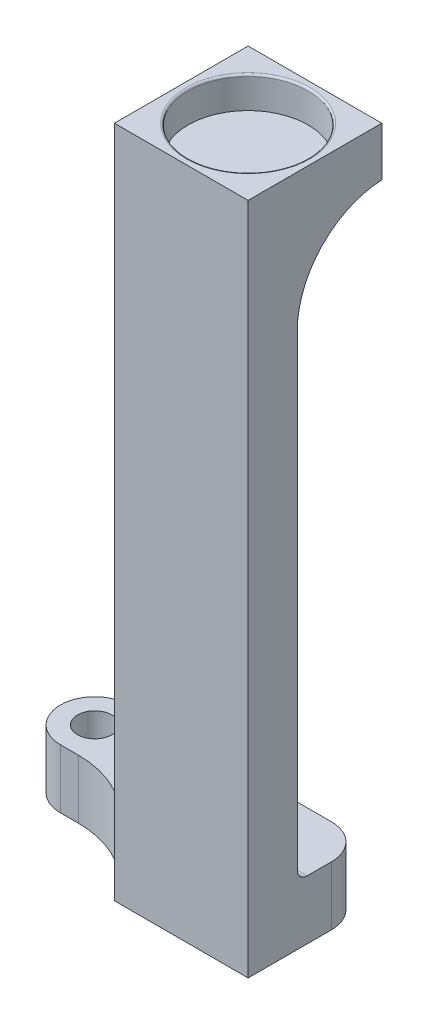
from build123d import *

# Parameters (mm, degrees)
SKETCH1_W           = 13.6
SKETCH1_H           = 13.6
BOSS_EXTRUDE1_DEPTH = 5
SKETCH2_R           = 6.1
CUT_EXTRUDE1_DEPTH  = 3.2
SKETCH3_W           = 13.6
SKETCH3_H           = 5
BOSS_EXTRUDE2_DEPTH = 63.5
FILLET1_R           = 0.2
FILLET2_R           = 9
SKETCH10_W          = 27.6
SKETCH10_H          = 6
BOSS_EXTRUDE5_DEPTH = 7
SKETCH11_R          = 1.75
CUT_EXTRUDE4_DEPTH  = 67.220314104
FILLET3_R           = 10
FILLET4_R           = 3.5
FILLET5_R           = 1


# Some blends are built 0.0001 mm under size
with BuildPart() as part:
    # Sketch1 → Boss-Extrude1 (new body)
    with BuildSketch(Plane(origin=(0, 0, 0), x_dir=(1, 0, 0), z_dir=(0, 1, 0))):
        Rectangle(SKETCH1_W, SKETCH1_H)
    extrude(amount=BOSS_EXTRUDE1_DEPTH)

    # Sketch2 → Cut-Extrude1 (cut)
    with BuildSketch(Plane(origin=(0, 5, 0), x_dir=(1, 0, 0), z_dir=(0, 1, 0))):
        with Locations(Location((0, 0, 0), (0, 0, 270))):
            Circle(SKETCH2_R)
    extrude(amount=-CUT_EXTRUDE1_DEPTH, mode=Mode.SUBTRACT)

    # Sketch3 → Boss-Extrude2 (add)
    with BuildSketch(Plane.XZ):
        with Locations((0, 4.3)):
            Rectangle(SKETCH3_W, SKETCH3_H)
    extrude(amount=BOSS_EXTRUDE2_DEPTH)

    # Fillet1
    fillet1_edges = [part.edges().sort_by_distance(p)[0] for p in [
        (0, 5, -6.1),
    ]]
    fillet(fillet1_edges, radius=FILLET1_R)

    # Fillet2
    # the kernel refuses this fillet: 9 mm, written as the material it adds along each edge
    with BuildSketch(Plane(origin=(6.8, 0, 1.8), x_dir=(0, 0, -1), z_dir=(-1, 0, 0))) as fillet2_piece_1:
        with BuildLine():
            CenterArc((9, 8.991106717), FILLET2_R, 180, 87.452681817)
            Line((0, 8.991106717), (-0.18, 8.991106717))
            Line((-0.18, 8.991106717), (-0.18, 0))
            Line((-0.18, 0), (0, -0.18))
            ThreePointArc((0, -0.18), (4.3, -0.18), (8.592, -0.179822134))
            Line((8.592, -0.179822134), (8.6, 0))
        make_face()
    extrude(amount=13.6)

    # Sketch10 → Boss-Extrude5 (add)
    with BuildSketch(Plane(origin=(0, 0, 1.8), x_dir=(-1, 0, 0), z_dir=(0, 0, -1))):
        with Locations((7, -60.5)):
            Rectangle(SKETCH10_W, SKETCH10_H)
    extrude(amount=BOSS_EXTRUDE5_DEPTH)

    # Sketch11 → Cut-Extrude4 (cut, through all)
    with BuildSketch(Plane(origin=(0, -57.5, 0), x_dir=(1, 0, 0), z_dir=(0, 1, 0))):
        with Locations(Location((-10.3, 1.7, 0), (0, 0, 270))):
            Circle(SKETCH11_R)
        with Locations(Location((-17.3, 1.7, 0), (0, 0, 270))):
            Circle(SKETCH11_R)
    extrude(amount=-CUT_EXTRUDE4_DEPTH, mode=Mode.SUBTRACT)

    # Fillet3
    # the kernel refuses this fillet: 10 mm, written as the material it adds along each edge
    with BuildSketch(Plane(origin=(-6.8, -57.5, 1.8), x_dir=(0, 0, 1), z_dir=(0, -1, 0))) as fillet3_piece_1:
        with BuildLine():
            CenterArc((10, 8.660254038), FILLET3_R, 180, 60)
            Line((0, 8.660254038), (0, 0))
            Line((0, 0), (5, 0))
        make_face()
    extrude(amount=6)

    # Fillet4
    fillet4_edges = [part.edges().sort_by_distance(p)[0] for p in [
        (-20.8, -60.5, 1.8),
        (-20.8, -60.5, -5.2),
        (6.8, -60.5, -5.2),
    ]]
    fillet(fillet4_edges, radius=FILLET4_R - 0.0001)  # a hair under: the kernel refuses the full size

    # Fillet5
    fillet5_edges = [part.edges().sort_by_distance(p)[0] for p in [
        (0, -57.5, 1.8),
        (-6.8, -57.5, 4.3),
    ]]
    fillet(fillet5_edges, radius=FILLET5_R)


solid = part.part
